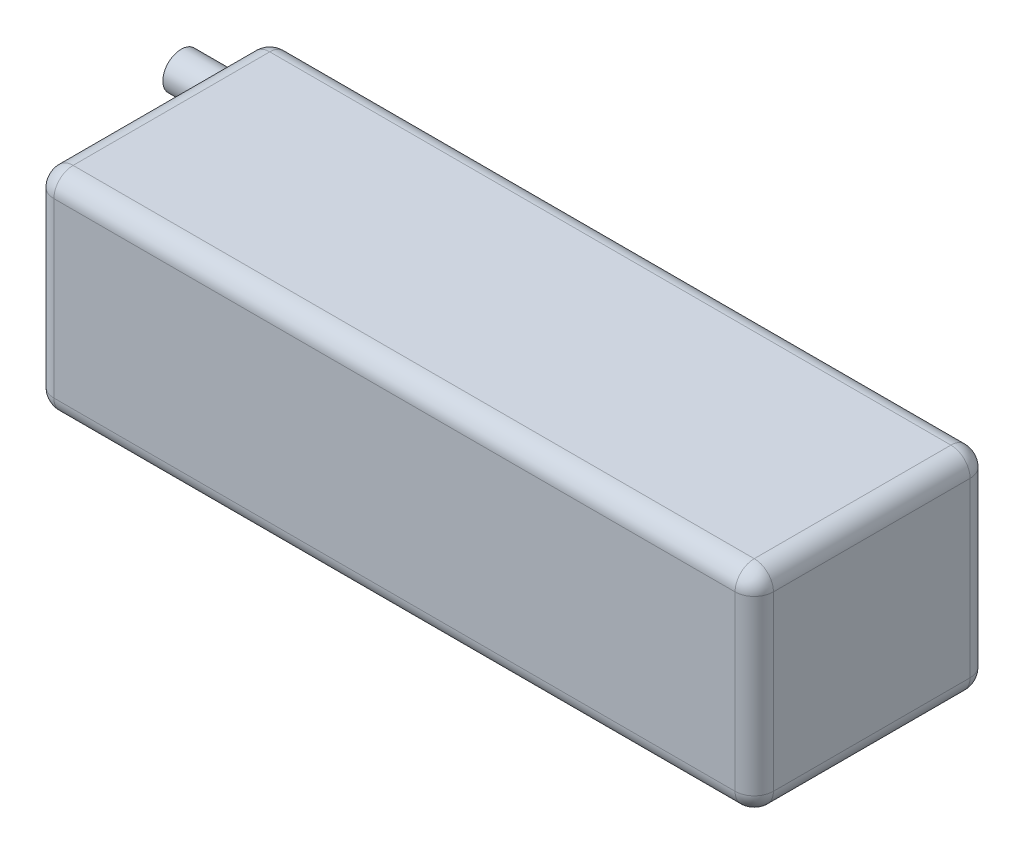
from build123d import *

# Parameters (mm, degrees)
SKETCH1_W             = 150
SKETCH1_H             = 49
BOSS_EXTRUDE1_DEPTH   = 44
SKETCH2_R             = 3.824497405
BOSS_EXTRUDE2_DEPTH   = 10
BOSS_EXTRUDE2_2_DEPTH = 10
FILLET1_R             = 4


with BuildPart() as part:
    # Sketch1 → Boss-Extrude1 (new body)
    with BuildSketch(Plane(origin=(0, 0, 0), x_dir=(1, 0, 0), z_dir=(0, 1, 0))):
        with Locations((75, 24.5)):
            Rectangle(SKETCH1_W, SKETCH1_H)
    extrude(amount=BOSS_EXTRUDE1_DEPTH)

    # Fillet1
    fillet1_edges = [part.edges().sort_by_distance(p)[0] for p in [
        (150, 44, -24.5),
        (75, 44, 0),
        (150, 22, 0),
        (0, 44, -24.5),
        (0, 22, 0),
        (75, 0, 0),
        (150, 0, -24.5),
        (0, 0, -24.5),
        (150, 22, -49),
        (75, 44, -49),
        (0, 22, -49),
        (75, 0, -49),
    ]]
    fillet(fillet1_edges, radius=FILLET1_R)


with BuildPart() as body_2:
    # Sketch2 → Boss-Extrude2 (new body)
    with BuildSketch(Plane.ZY):
        with Locations((-40.529448577, 35.886898519)):
            Circle(SKETCH2_R)
    extrude(amount=BOSS_EXTRUDE2_DEPTH)


with BuildPart() as body_3:
    # Sketch2 → Boss-Extrude2 2 (new body)
    with BuildSketch(Plane.ZY):
        with Locations((-40.529448577, 8.906638539)):
            Circle(SKETCH2_R)
    extrude(amount=BOSS_EXTRUDE2_2_DEPTH)


solid = Compound([part.part, body_2.part, body_3.part])
